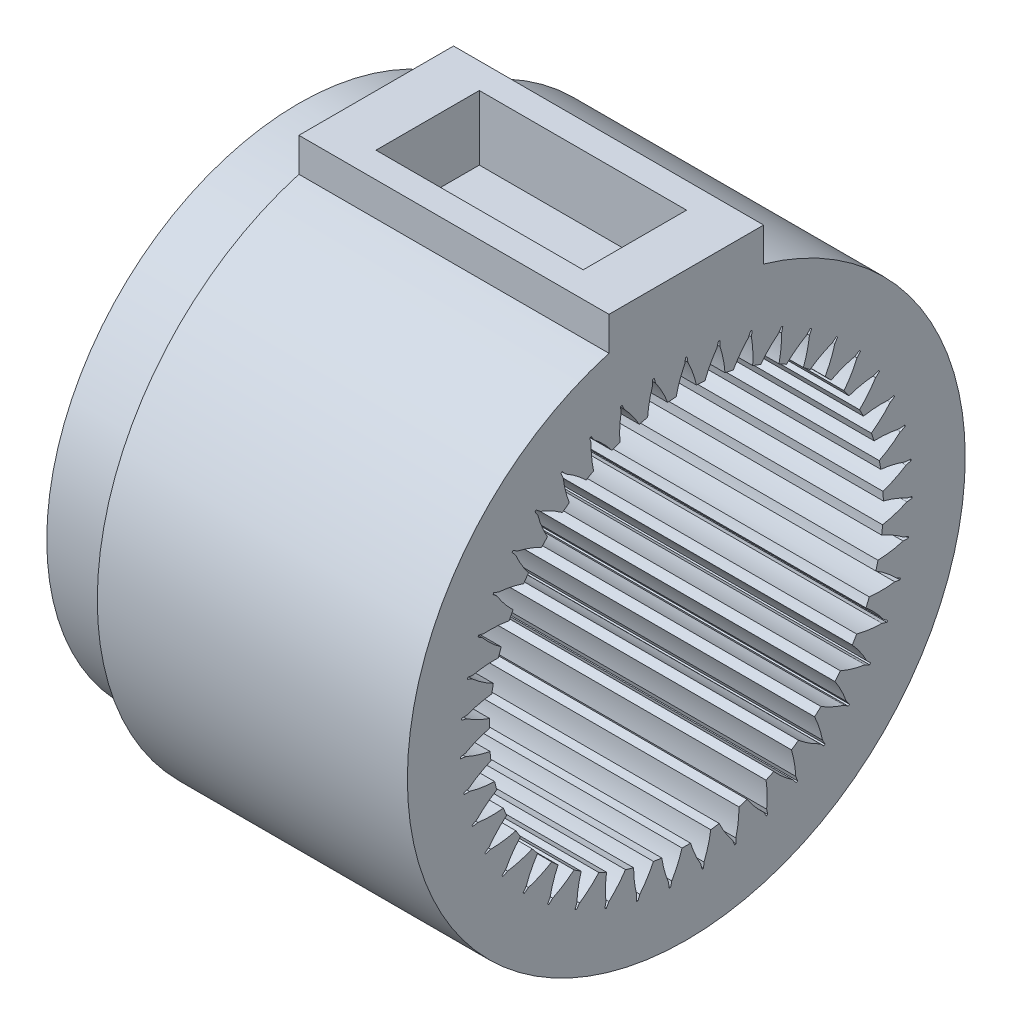
from build123d import *

# Parameters (mm, degrees)
BASPROSKE_W            = 78.047300112
BASPROSKE_H            = 4.5264
TOOTHCUT_DEPTH         = 102.176515302
TEETHCUTS_COUNT        = 43
TEETHCUTS_ANGLE        = 351.627906977
SCALE1_SCALE           = 0.373186685
SCALE2_SCALE           = 1.03
SKETCH2_R              = 19.499541689
SKETCH2_R_2            = 17.499541689
EXTRUDE_THIN1_DEPTH    = 4
BOSS_EXTRUDE2_DEPTH    = 24
BOSS_EXTRUDE3_DEPTH    = 11.9703915
SKETCH6_R              = 5
BOSS_EXTRUDE4_DEPTH    = 8
SKETCH7_R              = 4
CUT_EXTRUDE1_DEPTH     = 11.970392
SKETCH8_W              = 6
SKETCH8_H              = 6
BOSS_EXTRUDE5_DEPTH    = 2
CUT_EXTRUDE2_START     = -21.970391513
CUT_EXTRUDE2_OUTLINE_R = 1.665
CUT_EXTRUDE2_DEPTH     = 21.970391513
SKETCH10_R             = 2.5
CUT_EXTRUDE3_DEPTH     = 20
EXTRUDE_THIN2_START    = -23.999999605
SKETCH11_R             = 19.499541689
SKETCH11_R_2           = 17.499541689
EXTRUDE_THIN2_DEPTH    = 23.999999605
SKETCH12_R             = 2.7
BOSS_EXTRUDE6_DEPTH    = 8
SKETCH13_W             = 173.845873093
SKETCH13_H             = 84.02809251
CUT_EXTRUDE4_DEPTH     = 50
BOSS_EXTRUDE7_DEPTH    = 30
BOSS_EXTRUDE8_REACH    = 42.021
SKETCH15_R             = 19.499541689
SKETCH15_R_2           = 17.499541689
SKETCH16_R             = 21.589174891
SKETCH16_R_2           = 19.499541689
BOSS_EXTRUDE9_DEPTH    = 23.999999605
SKETCH17_W             = 16.039575366
SKETCH17_H             = 8
CUT_EXTRUDE5_DEPTH     = 5


with BuildPart() as part:
    # BasProSke → Base-Revolve (revolve)
    with BuildSketch(Plane(origin=(0, 0, 0), x_dir=(1, 0, 0), z_dir=(0, 1, 0)), mode=Mode.PRIVATE) as base_revolve_sk:
        with Locations((39.023650056, 43.2632)):
            Rectangle(BASPROSKE_W, BASPROSKE_H)
    revolve(base_revolve_sk.sketch.rotate(Axis((-10, 0, 0), (1, 0, 0)), 180), axis=Axis((-10, 0, 0), (1, 0, 0)))

    # TooCutSke → ToothCut (cut, through all)
    with BuildSketch(Plane(origin=(0, 0, 0), x_dir=(0, 0, -1), z_dir=(1, 0, 0))):
        with BuildLine():
            ThreePointArc((2.427408244, 40.90263481), (1.622102306, 43.254489753), (0.55070415, 45.497667258))
            ThreePointArc((0.55070415, 45.497667258), (0, 45.501), (-0.55070415, 45.497667258))
            ThreePointArc((-0.55070415, 45.497667258), (-1.622102306, 43.254489753), (-2.427408244, 40.90263481))
            ThreePointArc((-2.427408244, 40.90263481), (0, 40.9746), (2.427408244, 40.90263481))
        make_face()
    toothcut = extrude(amount=TOOTHCUT_DEPTH, mode=Mode.SUBTRACT)

    # TeethCuts: ToothCut ×43 about axis
    teethcuts_axis = Axis((-10, 0, 0), (1, 0, 0))
    for i in range(1, TEETHCUTS_COUNT):
        add(toothcut.rotate(teethcuts_axis, i * TEETHCUTS_ANGLE / (TEETHCUTS_COUNT - 1)), mode=Mode.SUBTRACT)


with BuildPart() as part_1:
    # Scale1: scaled about (39.023650056, 0, 0)
    add(part.part.scale(SCALE1_SCALE).moved(Location((24.460543452, 0, 0))))


with BuildPart() as part_2:
    # Scale2: scaled about (39.023650056, 0, 0)
    add(part_1.part.scale(SCALE2_SCALE).moved(Location((-1.170709502, 0, 0))))



with BuildPart() as body_2:
    # Sketch2 → Extrude-Thin1 (new body)
    with BuildSketch(Plane.ZY.offset(-24.023650253)):
        Circle(SKETCH2_R)
        Circle(SKETCH2_R_2, mode=Mode.SUBTRACT)
    extrude(amount=-EXTRUDE_THIN1_DEPTH)



with BuildPart() as body_3:
    # Sketch4 → Boss-Extrude2 (new, through all)
    with BuildSketch(Plane(origin=(30.023650253, 0, 0), x_dir=(0, 0, -1), z_dir=(1, 0, 0))):
        with BuildLine():
            Line((-5.985195757, 61.444190192), (5.985195757, 61.444190192))
            Line((5.985195757, 61.444190192), (5.985195757, 16.444190192))
            ThreePointArc((5.985195757, 16.444190192), (0, 17.499541689), (-5.985195757, 16.444190192))
            Line((-5.985195757, 16.444190192), (-5.985195757, 61.444190192))
        make_face()
    extrude(amount=BOSS_EXTRUDE2_DEPTH)

    # Sketch5 → Boss-Extrude3 (add)
    with BuildSketch(Plane.XY.offset(5.985195757)):
        Polygon((30.023650253, 46.444190192), (17.023650056, 53.927504623), (17.023650056, 66.91737825), (32.023650056, 96.91737825), (42.023650056, 96.91737825), (52.023650056, 96.91737825), (67.023650056, 66.91737825), (67.023650056, 53.927504623), (54.023649859, 46.444190192), (54.023649859, 61.444190192), (57.023650056, 61.444190192), (57.023650056, 66.91737825), (27.023650056, 66.91737825), (27.023650056, 61.444190192), (30.023650253, 61.444190192), align=None)
    extrude(amount=-BOSS_EXTRUDE3_DEPTH)

    # Sketch6 → Boss-Extrude4 (add)
    with BuildSketch(Plane.XY.offset(5.985195757)):
        with Locations((22.023650056, 66.444190192)):
            Circle(SKETCH6_R)
        with Locations((62.023650056, 66.444190192)):
            Circle(SKETCH6_R)
    extrude(amount=BOSS_EXTRUDE4_DEPTH)

    # Sketch7 → Cut-Extrude1 (cut)
    with BuildSketch(Plane.XY.offset(5.985195757)):
        with Locations((47.023650056, 46.444190192)):
            Circle(SKETCH7_R)
    extrude(amount=-CUT_EXTRUDE1_DEPTH, mode=Mode.SUBTRACT)

    # Sketch8 → Boss-Extrude5 (add, symmetric)
    with BuildSketch(Plane(origin=(0, 0, -5.985195757), x_dir=(-1, 0, 0), z_dir=(0, 0, -1))):
        Polygon((-54.023649859, 27.444190192), (-66.023650056, 27.444190192), (-66.023650056, 33.444190192), (-49.523649859, 33.444190192), (-46.523649859, 33.444190192), (-46.523649859, 27.444190192), align=None)
        with Locations((-31.023650056, 30.444190192)):
            Rectangle(SKETCH8_W, SKETCH8_H)
        with Locations((-63.023650056, 62.444190192)):
            Rectangle(SKETCH8_W, SKETCH8_H)
        with Locations((-31.023650056, 62.444190192)):
            Rectangle(SKETCH8_W, SKETCH8_H)
    extrude(amount=BOSS_EXTRUDE5_DEPTH, both=True)

    # Cut-Extrude2: read off the stored shape, not the designer's step
    # Cut-Extrude2 outline → Cut-Extrude2 (cut)
    with BuildSketch(Plane(origin=(0, 0, -7.985195757), x_dir=(-1, 0, 0), z_dir=(0, 0, -1)).offset(CUT_EXTRUDE2_START)):
        with Locations((-31.023650056, 62.444190192)):
            Circle(CUT_EXTRUDE2_OUTLINE_R)
        with Locations((-63.023650056, 62.444190192)):
            Circle(CUT_EXTRUDE2_OUTLINE_R)
        with Locations((-31.023650056, 30.444190192)):
            Circle(CUT_EXTRUDE2_OUTLINE_R)
        with Locations((-63.023650056, 30.444190192)):
            Circle(CUT_EXTRUDE2_OUTLINE_R)
    extrude(amount=CUT_EXTRUDE2_DEPTH, mode=Mode.SUBTRACT)

    # Sketch10 → Cut-Extrude3 (cut)
    with BuildSketch(Plane.XY.offset(13.985195757)):
        with Locations((31.023650056, 62.444190192)):
            Circle(SKETCH10_R)
        with Locations((31.023650056, 30.444190192)):
            Circle(SKETCH10_R)
        with Locations((63.023650056, 30.444190192)):
            Circle(SKETCH10_R)
        with Locations((63.023650056, 62.444190192)):
            Circle(SKETCH10_R)
    extrude(amount=-CUT_EXTRUDE3_DEPTH, mode=Mode.SUBTRACT)


with BuildPart() as part_3:
    add(part_2.part)

    add(body_3.part)  # Extrude-Thin2 merges body 3
    # Sketch11 → Extrude-Thin2 (add)
    with BuildSketch(Plane.ZY.offset(-30.023650253).offset(EXTRUDE_THIN2_START)):
        Circle(SKETCH11_R)
        Circle(SKETCH11_R_2, mode=Mode.SUBTRACT)
    extrude(amount=EXTRUDE_THIN2_DEPTH)

    # Sketch12 → Boss-Extrude6 (add)
    with BuildSketch(Plane.XY.offset(5.985195757)):
        with Locations(Location((36.141395741, 90.320034105, 0), (0, 0, 180))):
            Circle(SKETCH12_R)
        with Locations(Location((47.905904371, 90.320034105, 0), (0, 0, 180))):
            Circle(SKETCH12_R)
    extrude(amount=BOSS_EXTRUDE6_DEPTH)

    # Sketch13 → Cut-Extrude4 (cut, symmetric)
    with BuildSketch(Plane.XY.offset(5.985195757)):
        with Locations((46.749603736, 65.369634707)):
            Rectangle(SKETCH13_W, SKETCH13_H)
    extrude(amount=CUT_EXTRUDE4_DEPTH, both=True, mode=Mode.SUBTRACT)


with BuildPart() as body_2_1:
    add(body_2.part)

    add(part_3.part)  # Boss-Extrude7 merges part
    # Sketch14 → Boss-Extrude7 (add, through all)
    with BuildSketch(Plane(origin=(54.023649859, 0, 0), x_dir=(0, 0, -1), z_dir=(1, 0, 0))):
        with BuildLine():
            Line((-17.073266461, -0.747290891), (-17.475823879, -0.698518082))
            ThreePointArc((-17.475823879, -0.698518082), (-17.472626074, -0.774393841), (-17.469098837, -0.850255))
            ThreePointArc((-17.469098837, -0.850255), (-16.597243262, -1.228538149), (-15.687722275, -1.504222496))
            ThreePointArc((-15.687722275, -1.504222496), (-15.665131038, -1.723654557), (-15.639470648, -1.942748915))
            ThreePointArc((-15.639470648, -1.942748915), (-16.467290047, -2.409595065), (-17.236037071, -2.968395833))
            ThreePointArc((-17.236037071, -2.968395833), (-17.222985417, -3.043209007), (-17.209609037, -3.117964805))
            Line((-17.209609037, -3.117964805), (-16.827287133, -2.982830712))
            ThreePointArc((-16.827287133, -2.982830712), (-16.00364301, -2.436275755), (-15.118882336, -1.995469092))
            ThreePointArc((-15.118882336, -1.995469092), (-15.158514872, -1.667910928), (-15.191051539, -1.339571996))
            ThreePointArc((-15.191051539, -1.339571996), (-16.15048976, -1.101684914), (-17.073266461, -0.747290891))
        make_face()
        with BuildLine():
            Line((-17.000129371, 1.746560246), (-17.391295504, 1.853426132))
            ThreePointArc((-17.391295504, 1.853426132), (-17.399179377, 1.777893349), (-17.406735202, 1.702327045))
            ThreePointArc((-17.406735202, 1.702327045), (-16.599249138, 1.20113193), (-15.739560545, 0.795958131))
            ThreePointArc((-15.739560545, 0.795958131), (-15.749159619, 0.575575167), (-15.755673076, 0.355079434))
            ThreePointArc((-15.755673076, 0.355079434), (-16.642644054, 0.013739763), (-17.484560868, -0.427175606))
            ThreePointArc((-17.484560868, -0.427175606), (-17.482541186, -0.50309186), (-17.480191885, -0.57899863))
            Line((-17.480191885, -0.57899863), (-17.082268563, -0.500971126))
            ThreePointArc((-17.082268563, -0.500971126), (-16.187822671, -0.080164151), (-15.248308602, 0.227122811))
            ThreePointArc((-15.248308602, 0.227122811), (-15.239825938, 0.556960852), (-15.224209341, 0.886538173))
            ThreePointArc((-15.224209341, 0.886538173), (-16.138786545, 1.261585505), (-17.000129371, 1.746560246))
        make_face()
        with BuildLine():
            Line((-16.564664038, 4.203186485), (-16.93610186, 4.365867786))
            ThreePointArc((-16.93610186, 4.365867786), (-16.954899379, 4.292287829), (-16.973377226, 4.218626944))
            ThreePointArc((-16.973377226, 4.218626944), (-16.247470839, 3.605201967), (-15.455937408, 3.079174294))
            ThreePointArc((-15.455937408, 3.079174294), (-15.497522206, 2.862537505), (-15.536070687, 2.645339881))
            ThreePointArc((-15.536070687, 2.645339881), (-16.463288996, 2.436781752), (-17.360431605, 2.123149127))
            ThreePointArc((-17.360431605, 2.123149127), (-17.369486942, 2.047747816), (-17.378214791, 1.972307896))
            Line((-17.378214791, 1.972307896), (-16.973171095, 1.991565789))
            ThreePointArc((-16.973171095, 1.991565789), (-16.026986998, 2.277656013), (-15.052743644, 2.444873985))
            ThreePointArc((-15.052743644, 2.444873985), (-14.996326572, 2.769961977), (-14.932889553, 3.09375332))
            ThreePointArc((-14.932889553, 3.09375332), (-15.783113114, 3.59796742), (-16.564664038, 4.203186485))
        make_face()
        with BuildLine():
            Line((-15.77615165, 6.5702291), (-16.119944609, 6.785258548))
            ThreePointArc((-16.119944609, 6.785258548), (-16.149255136, 6.715199646), (-16.178261183, 6.645014134))
            ThreePointArc((-16.178261183, 6.645014134), (-15.549405906, 5.932433384), (-14.842897799, 5.296763201))
            ThreePointArc((-14.842897799, 5.296763201), (-14.915582012, 5.088489827), (-14.985343925, 4.879219502))
            ThreePointArc((-14.985343925, 4.879219502), (-15.933047516, 4.807887969), (-16.866294884, 4.628222622))
            ThreePointArc((-16.866294884, 4.628222622), (-16.88623224, 4.554943303), (-16.905851219, 4.481578104))
            Line((-16.905851219, 4.481578104), (-16.502319954, 4.441655937))
            ThreePointArc((-16.502319954, 4.441655937), (-15.524563921, 4.586931893), (-14.536355588, 4.610516915))
            ThreePointArc((-14.536355588, 4.610516915), (-14.433206541, 4.923926173), (-14.323301149, 5.235030486))
            ThreePointArc((-14.323301149, 5.235030486), (-15.09105003, 5.857664905), (-15.77615165, 6.5702291))
        make_face()
        with BuildLine():
            Line((-14.65139798, 8.79723869), (-14.960218724, 9.060033304))
            ThreePointArc((-14.960218724, 9.060033304), (-14.999417559, 8.994988641), (-15.038333591, 8.929774384))
            ThreePointArc((-15.038333591, 8.929774384), (-14.519932382, 8.133225282), (-13.913507593, 7.401460798))
            ThreePointArc((-13.913507593, 7.401460798), (-14.015742084, 7.205989822), (-14.115230573, 7.00910703))
            ThreePointArc((-14.115230573, 7.00910703), (-15.063220791, 7.0765224), (-16.012682369, 7.034653588))
            ThreePointArc((-16.012682369, 7.034653588), (-16.043076814, 6.965058081), (-16.07316878, 6.895331255))
            Line((-16.07316878, 6.895331255), (-15.679750513, 6.7970799))
            ThreePointArc((-15.679750513, 6.7970799), (-14.691261718, 6.798445284), (-13.71015035, 6.677894682))
            ThreePointArc((-13.71015035, 6.677894682), (-13.56246777, 6.97294543), (-13.408436449, 7.264732066))
            ThreePointArc((-13.408436449, 7.264732066), (-14.077347414, 7.992516433), (-14.65139798, 8.79723869))
        make_face()
        with BuildLine():
            Line((-13.214375198, 10.83675041), (-13.481641751, 11.14170918))
            ThreePointArc((-13.481641751, 11.14170918), (-13.529893437, 11.08306507), (-13.577890027, 11.024211997))
            ThreePointArc((-13.577890027, 11.024211997), (-13.180991709, 10.160671604), (-12.687575129, 9.348409107))
            ThreePointArc((-12.687575129, 9.348409107), (-12.817180947, 9.169906655), (-12.944275588, 8.98960761))
            ThreePointArc((-12.944275588, 8.98960761), (-13.872347666, 9.194333043), (-14.81778733, 9.291153125))
            ThreePointArc((-14.81778733, 9.291153125), (-14.85799106, 9.226724739), (-14.897914654, 9.162122391))
            Line((-14.897914654, 9.162122391), (-14.522994413, 9.007635906))
            ThreePointArc((-14.522994413, 9.007635906), (-13.544840777, 8.865061617), (-12.591737061, 8.602944717))
            ThreePointArc((-12.591737061, 8.602944717), (-12.402668546, 8.873348462), (-12.207794205, 9.139598495))
            ThreePointArc((-12.207794205, 9.139598495), (-12.763610578, 9.957021349), (-13.214375198, 10.83675041))
        make_face()
        with BuildLine():
            Line((-11.495710951, 12.645295609), (-11.71572699, 12.985918868))
            ThreePointArc((-11.71572699, 12.985918868), (-11.772003126, 12.934925208), (-11.828057311, 12.883687671))
            ThreePointArc((-11.828057311, 12.883687671), (-11.561121081, 11.971560851), (-11.191229028, 11.096112307))
            ThreePointArc((-11.191229028, 11.096112307), (-11.34544385, 10.938382848), (-11.497435842, 10.778510312))
            ThreePointArc((-11.497435842, 10.778510312), (-12.385809536, 11.116182439), (-13.30707688, 11.349627865))
            ThreePointArc((-13.30707688, 11.349627865), (-13.356233021, 11.291739778), (-13.405137342, 11.233638795))
            Line((-13.405137342, 11.233638795), (-13.0567059, 11.026209791))
            ThreePointArc((-13.0567059, 11.026209791), (-12.109735071, 10.742734552), (-11.204952757, 10.344637921))
            ThreePointArc((-11.204952757, 10.344637921), (-10.978527975, 10.584631477), (-10.746964022, 10.81967025))
            ThreePointArc((-10.746964022, 10.81967025), (-11.177839542, 11.709309642), (-11.495710951, 12.645295609))
        make_face()
        with BuildLine():
            Line((-9.532035584, 14.184328287), (-9.700111849, 14.553356241))
            ThreePointArc((-9.700111849, 14.553356241), (-9.763213007, 14.511099873), (-9.826130088, 14.46856991))
            ThreePointArc((-9.826130088, 14.46856991), (-9.69484523, 13.527297064), (-9.456361311, 12.607321137))
            ThreePointArc((-9.456361311, 12.607321137), (-9.631898315, 12.473726401), (-9.805548212, 12.337687779))
            ThreePointArc((-9.805548212, 12.337687779), (-10.635289379, 12.801109706), (-11.512749189, 13.166204991))
            ThreePointArc((-11.512749189, 13.166204991), (-11.569810065, 13.116090988), (-11.626652801, 13.065729692))
            Line((-11.626652801, 13.065729692), (-11.31213637, 12.809779158))
            ThreePointArc((-11.31213637, 12.809779158), (-10.416531386, 12.391444751), (-9.579354338, 11.865853128))
            ThreePointArc((-9.579354338, 11.865853128), (-9.32039914, 12.070321449), (-9.057080959, 12.269139517))
            ThreePointArc((-9.057080959, 12.269139517), (-9.353832263, 13.212034329), (-9.532035584, 14.184328287))
        make_face()
        with BuildLine():
            Line((-7.365201427, 15.421046633), (-7.477755664, 15.810614092))
            ThreePointArc((-7.477755664, 15.810614092), (-7.546336953, 15.777995638), (-7.614775962, 15.745079701))
            ThreePointArc((-7.614775962, 15.745079701), (-7.621940584, 14.794722424), (-7.519947669, 13.849826805))
            ThreePointArc((-7.519947669, 13.849826805), (-7.71306559, 13.743214132), (-7.904672346, 13.633908852))
            ThreePointArc((-7.904672346, 13.633908852), (-8.658096493, 14.213203544), (-9.473047237, 14.702167316))
            ThreePointArc((-9.473047237, 14.702167316), (-9.536796693, 14.66089549), (-9.600366341, 14.619347245))
            Line((-9.600366341, 14.619347245), (-9.326468293, 14.320330321))
            ThreePointArc((-9.326468293, 14.320330321), (-8.501317419, 13.776052819), (-7.749588613, 13.134168277))
            ThreePointArc((-7.749588613, 13.134168277), (-7.463622179, 13.298753474), (-7.17416194, 13.457113377))
            ThreePointArc((-7.17416194, 13.457113377), (-7.330464289, 14.433167443), (-7.365201427, 15.421046633))
        make_face()
        with BuildLine():
            Line((-5.041390789, 16.329092144), (-5.0960241, 16.730896154))
            ThreePointArc((-5.0960241, 16.730896154), (-5.168623828, 16.708610818), (-5.241126107, 16.686010454))
            ThreePointArc((-5.241126107, 16.686010454), (-5.386587507, 15.746823962), (-5.423259399, 14.797147461))
            ThreePointArc((-5.423259399, 14.797147461), (-5.629842263, 14.719789115), (-5.835322113, 14.639546828))
            ThreePointArc((-5.835322113, 14.639546828), (-6.496371312, 15.322367625), (-7.23144373, 15.92477847))
            ThreePointArc((-7.23144373, 15.92477847), (-7.300523058, 15.893228458), (-7.36946474, 15.861378792))
            Line((-7.36946474, 15.861378792), (-7.142022736, 15.525668506))
            ThreePointArc((-7.142022736, 15.525668506), (-6.404912632, 14.867048238), (-5.754653862, 14.122551431))
            ThreePointArc((-5.754653862, 14.122551431), (-5.447771069, 14.243745658), (-5.138338115, 14.358272229))
            ThreePointArc((-5.138338115, 14.358272229), (-5.150860196, 15.346682651), (-5.041390789, 16.329092144))
        make_face()
        with BuildLine():
            Line((-2.610131659, 16.889111405), (-2.605679629, 17.294588212))
            ThreePointArc((-2.605679629, 17.294588212), (-2.68075046, 17.283110967), (-2.755770748, 17.271307864))
            ThreePointArc((-2.755770748, 17.271307864), (-3.03642867, 16.363309287), (-3.21098377, 15.429092608))
            ThreePointArc((-3.21098377, 15.429092608), (-3.426628622, 15.382637348), (-3.64160212, 15.333168279))
            ThreePointArc((-3.64160212, 15.333168279), (-4.196187255, 16.104962043), (-4.835714555, 16.807980619))
            ThreePointArc((-4.835714555, 16.807980619), (-4.908651448, 16.786824855), (-4.981495793, 16.765352588))
            Line((-4.981495793, 16.765352588), (-4.805357364, 16.400104022))
            ThreePointArc((-4.805357364, 16.400104022), (-4.171998251, 15.641178336), (-3.637068654, 14.809936921))
            ThreePointArc((-3.637068654, 14.809936921), (-3.315810178, 14.885157133), (-2.992999534, 14.953409437))
            ThreePointArc((-2.992999534, 14.953409437), (-2.86147446, 15.933109962), (-2.610131659, 16.889111405))
        make_face()
        with BuildLine():
            Line((-0.123242104, 17.089168579), (-0.059799621, 17.489676148))
            ThreePointArc((-0.059799621, 17.489676148), (-0.13574155, 17.489251613), (-0.21168092, 17.488497332))
            ThreePointArc((-0.21168092, 17.488497332), (-0.621553627, 16.631039082), (-0.930271597, 15.732193434))
            ThreePointArc((-0.930271597, 15.732193434), (-1.150382342, 15.717631372), (-1.3702677, 15.69998987))
            ThreePointArc((-1.3702677, 15.69998987), (-1.806568753, 16.544307154), (-2.336920519, 17.332949842))
            ThreePointArc((-2.336920519, 17.332949842), (-2.412160455, 17.322639224), (-2.487354912, 17.312002001))
            Line((-2.487354912, 17.312002001), (-2.366274143, 16.924999793))
            ThreePointArc((-2.366274143, 16.924999793), (-1.850164971, 16.081943872), (-1.441965642, 15.181674318))
            ThreePointArc((-1.441965642, 15.181674318), (-1.113178549, 15.209317326), (-0.783870364, 15.229840684))
            ThreePointArc((-0.783870364, 15.229840684), (-0.511101364, 16.179950696), (-0.123242104, 17.089168579))
        make_face()
        with BuildLine():
            Line((2.366274143, 16.924999793), (2.487354912, 17.312002001))
            ThreePointArc((2.487354912, 17.312002001), (2.412160455, 17.322639224), (2.336920519, 17.332949842))
            ThreePointArc((2.336920519, 17.332949842), (1.806568753, 16.544307154), (1.3702677, 15.69998987))
            ThreePointArc((1.3702677, 15.69998987), (1.150382342, 15.717631372), (0.930271597, 15.732193434))
            ThreePointArc((0.930271597, 15.732193434), (0.621553627, 16.631039082), (0.21168092, 17.488497332))
            ThreePointArc((0.21168092, 17.488497332), (0.13574155, 17.489251613), (0.059799621, 17.489676148))
            Line((0.059799621, 17.489676148), (0.123242104, 17.089168579))
            ThreePointArc((0.123242104, 17.089168579), (0.511101364, 16.179950696), (0.783870364, 15.229840684))
            ThreePointArc((0.783870364, 15.229840684), (1.113178549, 15.209317326), (1.441965642, 15.181674318))
            ThreePointArc((1.441965642, 15.181674318), (1.850164971, 16.081943872), (2.366274143, 16.924999793))
        make_face()
        with BuildLine():
            Line((4.805357364, 16.400104022), (4.981495793, 16.765352588))
            ThreePointArc((4.981495793, 16.765352588), (4.908651448, 16.786824855), (4.835714555, 16.807980619))
            ThreePointArc((4.835714555, 16.807980619), (4.196187255, 16.104962043), (3.64160212, 15.333168279))
            ThreePointArc((3.64160212, 15.333168279), (3.426628622, 15.382637348), (3.21098377, 15.429092608))
            ThreePointArc((3.21098377, 15.429092608), (3.03642867, 16.363309287), (2.755770748, 17.271307864))
            ThreePointArc((2.755770748, 17.271307864), (2.68075046, 17.283110967), (2.605679629, 17.294588212))
            Line((2.605679629, 17.294588212), (2.610131659, 16.889111405))
            ThreePointArc((2.610131659, 16.889111405), (2.86147446, 15.933109962), (2.992999534, 14.953409437))
            ThreePointArc((2.992999534, 14.953409437), (3.315810178, 14.885157133), (3.637068654, 14.809936921))
            ThreePointArc((3.637068654, 14.809936921), (4.171998251, 15.641178336), (4.805357364, 16.400104022))
        make_face()
        with BuildLine():
            Line((7.142022736, 15.525668506), (7.36946474, 15.861378792))
            ThreePointArc((7.36946474, 15.861378792), (7.300523058, 15.893228458), (7.23144373, 15.92477847))
            ThreePointArc((7.23144373, 15.92477847), (6.496371312, 15.322367625), (5.835322113, 14.639546828))
            ThreePointArc((5.835322113, 14.639546828), (5.629842263, 14.719789115), (5.423259399, 14.797147461))
            ThreePointArc((5.423259399, 14.797147461), (5.386587507, 15.746823962), (5.241126107, 16.686010454))
            ThreePointArc((5.241126107, 16.686010454), (5.168623828, 16.708610818), (5.0960241, 16.730896154))
            Line((5.0960241, 16.730896154), (5.041390789, 16.329092144))
            ThreePointArc((5.041390789, 16.329092144), (5.150860196, 15.346682651), (5.138338115, 14.358272229))
            ThreePointArc((5.138338115, 14.358272229), (5.447771069, 14.243745658), (5.754653862, 14.122551431))
            ThreePointArc((5.754653862, 14.122551431), (6.404912632, 14.867048238), (7.142022736, 15.525668506))
        make_face()
        with BuildLine():
            Line((9.326468293, 14.320330321), (9.600366341, 14.619347245))
            ThreePointArc((9.600366341, 14.619347245), (9.536796693, 14.66089549), (9.473047237, 14.702167316))
            ThreePointArc((9.473047237, 14.702167316), (8.658096493, 14.213203544), (7.904672346, 13.633908852))
            ThreePointArc((7.904672346, 13.633908852), (7.71306559, 13.743214132), (7.519947669, 13.849826805))
            ThreePointArc((7.519947669, 13.849826805), (7.621940584, 14.794722424), (7.614775962, 15.745079701))
            ThreePointArc((7.614775962, 15.745079701), (7.546336953, 15.777995638), (7.477755664, 15.810614092))
            Line((7.477755664, 15.810614092), (7.365201427, 15.421046633))
            ThreePointArc((7.365201427, 15.421046633), (7.330464289, 14.433167443), (7.17416194, 13.457113377))
            ThreePointArc((7.17416194, 13.457113377), (7.463622179, 13.298753474), (7.749588613, 13.134168277))
            ThreePointArc((7.749588613, 13.134168277), (8.501317419, 13.776052819), (9.326468293, 14.320330321))
        make_face()
        with BuildLine():
            Line((11.31213637, 12.809779158), (11.626652801, 13.065729692))
            ThreePointArc((11.626652801, 13.065729692), (11.569810065, 13.116090988), (11.512749189, 13.166204991))
            ThreePointArc((11.512749189, 13.166204991), (10.635289379, 12.801109706), (9.805548212, 12.337687779))
            ThreePointArc((9.805548212, 12.337687779), (9.631898315, 12.473726401), (9.456361311, 12.607321137))
            ThreePointArc((9.456361311, 12.607321137), (9.69484523, 13.527297064), (9.826130088, 14.46856991))
            ThreePointArc((9.826130088, 14.46856991), (9.763213007, 14.511099873), (9.700111849, 14.553356241))
            Line((9.700111849, 14.553356241), (9.532035584, 14.184328287))
            ThreePointArc((9.532035584, 14.184328287), (9.353832263, 13.212034329), (9.057080959, 12.269139517))
            ThreePointArc((9.057080959, 12.269139517), (9.32039914, 12.070321449), (9.579354338, 11.865853128))
            ThreePointArc((9.579354338, 11.865853128), (10.416531386, 12.391444751), (11.31213637, 12.809779158))
        make_face()
        with BuildLine():
            Line((13.0567059, 11.026209791), (13.405137342, 11.233638795))
            ThreePointArc((13.405137342, 11.233638795), (13.356233021, 11.291739778), (13.30707688, 11.349627865))
            ThreePointArc((13.30707688, 11.349627865), (12.385809536, 11.116182439), (11.497435842, 10.778510312))
            ThreePointArc((11.497435842, 10.778510312), (11.34544385, 10.938382848), (11.191229028, 11.096112307))
            ThreePointArc((11.191229028, 11.096112307), (11.561121081, 11.971560851), (11.828057311, 12.883687671))
            ThreePointArc((11.828057311, 12.883687671), (11.772003126, 12.934925208), (11.71572699, 12.985918868))
            Line((11.71572699, 12.985918868), (11.495710951, 12.645295609))
            ThreePointArc((11.495710951, 12.645295609), (11.177839542, 11.709309642), (10.746964022, 10.81967025))
            ThreePointArc((10.746964022, 10.81967025), (10.978527975, 10.584631477), (11.204952757, 10.344637921))
            ThreePointArc((11.204952757, 10.344637921), (12.109735071, 10.742734552), (13.0567059, 11.026209791))
        make_face()
        with BuildLine():
            Line((14.522994413, 9.007635906), (14.897914654, 9.162122391))
            ThreePointArc((14.897914654, 9.162122391), (14.85799106, 9.226724739), (14.81778733, 9.291153125))
            ThreePointArc((14.81778733, 9.291153125), (13.872347666, 9.194333043), (12.944275588, 8.98960761))
            ThreePointArc((12.944275588, 8.98960761), (12.817180947, 9.169906655), (12.687575129, 9.348409107))
            ThreePointArc((12.687575129, 9.348409107), (13.180991709, 10.160671604), (13.577890027, 11.024211997))
            ThreePointArc((13.577890027, 11.024211997), (13.529893437, 11.08306507), (13.481641751, 11.14170918))
            Line((13.481641751, 11.14170918), (13.214375198, 10.83675041))
            ThreePointArc((13.214375198, 10.83675041), (12.763610578, 9.957021349), (12.207794205, 9.139598495))
            ThreePointArc((12.207794205, 9.139598495), (12.402668546, 8.873348462), (12.591737061, 8.602944717))
            ThreePointArc((12.591737061, 8.602944717), (13.544840777, 8.865061617), (14.522994413, 9.007635906))
        make_face()
        with BuildLine():
            Line((15.679750513, 6.7970799), (16.07316878, 6.895331255))
            ThreePointArc((16.07316878, 6.895331255), (16.043076814, 6.965058081), (16.012682369, 7.034653588))
            ThreePointArc((16.012682369, 7.034653588), (15.063220791, 7.0765224), (14.115230573, 7.00910703))
            ThreePointArc((14.115230573, 7.00910703), (14.015742084, 7.205989822), (13.913507593, 7.401460798))
            ThreePointArc((13.913507593, 7.401460798), (14.519932382, 8.133225282), (15.038333591, 8.929774384))
            ThreePointArc((15.038333591, 8.929774384), (14.999417559, 8.994988641), (14.960218724, 9.060033304))
            Line((14.960218724, 9.060033304), (14.65139798, 8.79723869))
            ThreePointArc((14.65139798, 8.79723869), (14.077347414, 7.992516433), (13.408436449, 7.264732066))
            ThreePointArc((13.408436449, 7.264732066), (13.56246777, 6.97294543), (13.71015035, 6.677894682))
            ThreePointArc((13.71015035, 6.677894682), (14.691261718, 6.798445284), (15.679750513, 6.7970799))
        make_face()
        with BuildLine():
            Line((16.502319954, 4.441655937), (16.905851219, 4.481578104))
            ThreePointArc((16.905851219, 4.481578104), (16.88623224, 4.554943303), (16.866294884, 4.628222622))
            ThreePointArc((16.866294884, 4.628222622), (15.933047516, 4.807887969), (14.985343925, 4.879219502))
            ThreePointArc((14.985343925, 4.879219502), (14.915582012, 5.088489827), (14.842897799, 5.296763201))
            ThreePointArc((14.842897799, 5.296763201), (15.549405906, 5.932433384), (16.178261183, 6.645014134))
            ThreePointArc((16.178261183, 6.645014134), (16.149255136, 6.715199646), (16.119944609, 6.785258548))
            Line((16.119944609, 6.785258548), (15.77615165, 6.5702291))
            ThreePointArc((15.77615165, 6.5702291), (15.09105003, 5.857664905), (14.323301149, 5.235030486))
            ThreePointArc((14.323301149, 5.235030486), (14.433206541, 4.923926173), (14.536355588, 4.610516915))
            ThreePointArc((14.536355588, 4.610516915), (15.524563921, 4.586931893), (16.502319954, 4.441655937))
        make_face()
        with BuildLine():
            Line((16.973171095, 1.991565789), (17.378214791, 1.972307896))
            ThreePointArc((17.378214791, 1.972307896), (17.369486942, 2.047747816), (17.360431605, 2.123149127))
            ThreePointArc((17.360431605, 2.123149127), (16.463288996, 2.436781752), (15.536070687, 2.645339881))
            ThreePointArc((15.536070687, 2.645339881), (15.497522206, 2.862537505), (15.455937408, 3.079174294))
            ThreePointArc((15.455937408, 3.079174294), (16.247470839, 3.605201967), (16.973377226, 4.218626944))
            ThreePointArc((16.973377226, 4.218626944), (16.954899379, 4.292287829), (16.93610186, 4.365867786))
            Line((16.93610186, 4.365867786), (16.564664038, 4.203186485))
            ThreePointArc((16.564664038, 4.203186485), (15.783113114, 3.59796742), (14.932889553, 3.09375332))
            ThreePointArc((14.932889553, 3.09375332), (14.996326572, 2.769961977), (15.052743644, 2.444873985))
            ThreePointArc((15.052743644, 2.444873985), (16.026986998, 2.277656013), (16.973171095, 1.991565789))
        make_face()
        with BuildLine():
            Line((17.082268563, -0.500971126), (17.480191885, -0.57899863))
            ThreePointArc((17.480191885, -0.57899863), (17.482541186, -0.50309186), (17.484560868, -0.427175606))
            ThreePointArc((17.484560868, -0.427175606), (16.642644054, 0.013739763), (15.755673076, 0.355079434))
            ThreePointArc((15.755673076, 0.355079434), (15.749159619, 0.575575167), (15.739560545, 0.795958131))
            ThreePointArc((15.739560545, 0.795958131), (16.599249138, 1.20113193), (17.406735202, 1.702327045))
            ThreePointArc((17.406735202, 1.702327045), (17.399179377, 1.777893349), (17.391295504, 1.853426132))
            Line((17.391295504, 1.853426132), (17.000129371, 1.746560246))
            ThreePointArc((17.000129371, 1.746560246), (16.138786545, 1.261585505), (15.224209341, 0.886538173))
            ThreePointArc((15.224209341, 0.886538173), (15.239825938, 0.556960852), (15.248308602, 0.227122811))
            ThreePointArc((15.248308602, 0.227122811), (16.187822671, -0.080164151), (17.082268563, -0.500971126))
        make_face()
        with BuildLine():
            Line((16.827287133, -2.982830712), (17.209609037, -3.117964805))
            ThreePointArc((17.209609037, -3.117964805), (17.222985417, -3.043209007), (17.236037071, -2.968395833))
            ThreePointArc((17.236037071, -2.968395833), (16.467290047, -2.409595065), (15.639470648, -1.942748915))
            ThreePointArc((15.639470648, -1.942748915), (15.665131038, -1.723654557), (15.687722275, -1.504222496))
            ThreePointArc((15.687722275, -1.504222496), (16.597243262, -1.228538149), (17.469098837, -0.850255))
            ThreePointArc((17.469098837, -0.850255), (17.472626074, -0.774393841), (17.475823879, -0.698518082))
            Line((17.475823879, -0.698518082), (17.073266461, -0.747290891))
            ThreePointArc((17.073266461, -0.747290891), (16.15048976, -1.101684914), (15.191051539, -1.339571996))
            ThreePointArc((15.191051539, -1.339571996), (15.158514872, -1.667910928), (15.118882336, -1.995469092))
            ThreePointArc((15.118882336, -1.995469092), (16.00364301, -2.436275755), (16.827287133, -2.982830712))
        make_face()
        with BuildLine():
            Line((16.213661293, -5.401116439), (16.572233252, -5.590476974))
            ThreePointArc((16.572233252, -5.590476974), (16.596351616, -5.518465438), (16.620157069, -5.446349855))
            ThreePointArc((16.620157069, -5.446349855), (15.940964343, -4.781573557), (15.189940055, -4.199170944))
            ThreePointArc((15.189940055, -4.199170944), (15.247227387, -3.986147577), (15.301527441, -3.772343233))
            ThreePointArc((15.301527441, -3.772343233), (16.24149596, -3.63202407), (17.15913896, -3.384715335))
            ThreePointArc((17.15913896, -3.384715335), (17.173674082, -3.310176171), (17.187885408, -3.235574595))
            Line((17.187885408, -3.235574595), (16.782516518, -3.225214821))
            ThreePointArc((16.782516518, -3.225214821), (15.817973325, -3.441474832), (14.834122848, -3.537131514))
            ThreePointArc((14.834122848, -3.537131514), (14.75412638, -3.857234081), (14.667223342, -4.175531035))
            ThreePointArc((14.667223342, -4.175531035), (15.478373482, -4.740462371), (16.213661293, -5.401116439))
        make_face()
        with BuildLine():
            Line((15.254469412, -7.704286747), (15.581649086, -7.943837832))
            ThreePointArc((15.581649086, -7.943837832), (15.615995394, -7.876105358), (15.650047274, -7.808224387))
            ThreePointArc((15.650047274, -7.808224387), (15.07488466, -7.051641111), (14.416662262, -6.366094935))
            ThreePointArc((14.416662262, -6.366094935), (14.504355554, -6.163682782), (14.589207115, -5.960063023))
            ThreePointArc((14.589207115, -5.960063023), (15.53958937, -5.958099704), (16.483461827, -5.847036339))
            ThreePointArc((16.483461827, -5.847036339), (16.508695042, -5.775407842), (16.533617, -5.703670454))
            Line((16.533617, -5.703670454), (16.134076373, -5.634398897))
            ThreePointArc((16.134076373, -5.634398897), (15.148324251, -5.707915689), (14.161030582, -5.659303214))
            ThreePointArc((14.161030582, -5.659303214), (14.035279299, -5.964346987), (13.902957947, -6.266598784))
            ThreePointArc((13.902957947, -6.266598784), (14.623209296, -6.943614262), (15.254469412, -7.704286747))
        make_face()
        with BuildLine():
            Line((13.970154999, -9.843253558), (14.258969123, -10.127889578))
            ThreePointArc((14.258969123, -10.127889578), (14.302811341, -10.065879767), (14.346383892, -10.003680172))
            ThreePointArc((14.346383892, -10.003680172), (13.887509983, -9.171415177), (13.336118342, -8.397336665))
            ThreePointArc((13.336118342, -8.397336665), (13.452348565, -8.209849789), (13.565943169, -8.020754418))
            ThreePointArc((13.565943169, -8.020754418), (14.506483411, -8.157188787), (15.456468322, -8.184737916))
            ThreePointArc((15.456468322, -8.184737916), (15.49186183, -8.117546722), (15.526963251, -8.050202479))
            Line((15.526963251, -8.050202479), (15.1417664, -7.923495542))
            ThreePointArc((15.1417664, -7.923495542), (14.155814946, -7.852702232), (13.186120534, -7.660856692))
            ThreePointArc((13.186120534, -7.660856692), (13.017294608, -7.944340192), (12.842375141, -8.224104859))
            ThreePointArc((12.842375141, -8.224104859), (13.456376792, -8.99877507), (13.970154999, -9.843253558))
        make_face()
        with BuildLine():
            Line((12.388090987, -11.77242851), (12.632383988, -12.096082942))
            ThreePointArc((12.632383988, -12.096082942), (12.684787697, -12.041117425), (12.736952244, -11.985924882))
            ThreePointArc((12.736952244, -11.985924882), (12.404147141, -11.095716452), (11.971338213, -10.249603742))
            ThreePointArc((11.971338213, -10.249603742), (12.113628122, -10.081038102), (12.253544696, -9.910497357))
            ThreePointArc((12.253544696, -9.910497357), (13.164196944, -10.182421553), (14.10004703, -10.347996013))
            ThreePointArc((14.10004703, -10.347996013), (14.144846479, -10.286674188), (14.189379237, -10.225158415))
            Line((14.189379237, -10.225158415), (13.826735966, -10.043716635))
            ThreePointArc((13.826735966, -10.043716635), (12.861599022, -9.830122061), (11.930171221, -9.499132309))
            ThreePointArc((11.930171221, -9.499132309), (11.721868882, -9.755013579), (11.508079405, -10.006328418))
            ThreePointArc((11.508079405, -10.006328418), (12.002744979, -10.862142611), (12.388090987, -11.77242851))
        make_face()
        with BuildLine():
            Line((10.541996323, -13.450694586), (10.73656152, -13.806469298))
            ThreePointArc((10.73656152, -13.806469298), (10.796409825, -13.759719569), (10.856054573, -13.712710412))
            ThreePointArc((10.856054573, -13.712710412), (10.656411438, -12.783531794), (10.351409794, -11.883418311))
            ThreePointArc((10.351409794, -11.883418311), (10.516726726, -11.737366589), (10.679983193, -11.589015251))
            ThreePointArc((10.679983193, -11.589015251), (11.541338474, -11.990633682), (12.443107716, -12.290704541))
            ThreePointArc((12.443107716, -12.290704541), (12.496358282, -12.236559052), (12.549373239, -12.182182852))
            Line((12.549373239, -12.182182852), (12.217012659, -11.949873347))
            ThreePointArc((12.217012659, -11.949873347), (11.293260444, -11.598029905), (10.419951021, -11.134950414))
            ThreePointArc((10.419951021, -11.134950414), (10.176611871, -11.357775787), (9.928508936, -11.575284459))
            ThreePointArc((9.928508936, -11.575284459), (10.293295495, -12.49400244), (10.541996323, -13.450694586))
        make_face()
        with BuildLine():
            Line((8.47121731, -14.842282459), (8.611907884, -15.222594731))
            ThreePointArc((8.611907884, -15.222594731), (8.677925223, -15.18505718), (8.743778947, -15.147233327))
            ThreePointArc((8.743778947, -15.147233327), (8.681552827, -14.19888835), (8.510859048, -13.26395845))
            ThreePointArc((8.510859048, -13.26395845), (8.695679559, -13.143533486), (8.878796389, -13.020533405))
            ThreePointArc((8.878796389, -13.020533405), (9.672496412, -13.543286271), (10.520965164, -13.97145804))
            ThreePointArc((10.520965164, -13.97145804), (10.581531905, -13.925642904), (10.641899139, -13.879565211))
            Line((10.641899139, -13.879565211), (10.346904939, -13.601339254))
            ThreePointArc((10.346904939, -13.601339254), (9.484225626, -13.118745878), (8.687647655, -12.533446382))
            ThreePointArc((8.687647655, -12.533446382), (8.414458047, -12.718466723), (8.137329537, -12.897533408))
            ThreePointArc((8.137329537, -12.897533408), (8.364462289, -13.859574299), (8.47121731, -14.842282459))
        make_face()
        with BuildLine():
            Line((6.219889007, -15.917532851), (6.303706382, -16.314276986))
            ThreePointArc((6.303706382, -16.314276986), (6.37448571, -16.286751661), (6.445144852, -16.258919262))
            ThreePointArc((6.445144852, -16.258919262), (6.52166199, -15.311620253), (6.488914116, -14.361800343))
            ThreePointArc((6.488914116, -14.361800343), (6.689299079, -14.269568785), (6.888373456, -14.174541496))
            ThreePointArc((6.888373456, -14.174541496), (7.597501882, -14.807287227), (8.374586505, -15.354434168))
            ThreePointArc((8.374586505, -15.354434168), (8.441178545, -15.317925855), (8.507611435, -15.281128735))
            Line((8.507611435, -15.281128735), (8.256270903, -14.96291623))
            ThreePointArc((8.256270903, -14.96291623), (7.473051006, -14.359858558), (6.770182163, -13.664813701))
            ThreePointArc((6.770182163, -13.664813701), (6.472964658, -13.808085622), (6.172717086, -13.944893824))
            ThreePointArc((6.172717086, -13.944893824), (6.257355091, -14.929753394), (6.219889007, -15.917532851))
        make_face()
        with BuildLine():
            Line((3.835994569, -16.653528665), (3.861152324, -17.058248752))
            ThreePointArc((3.861152324, -17.058248752), (3.935185102, -17.041322307), (4.009143685, -17.024074561))
            ThreePointArc((4.009143685, -17.024074561), (4.222773249, -16.098011553), (4.328669246, -15.153545395))
            ThreePointArc((4.328669246, -15.153545395), (4.540347803, -15.091473), (4.751136802, -15.026443843))
            ThreePointArc((4.751136802, -15.026443843), (5.36057979, -15.755696563), (6.049718074, -16.410157189))
            ThreePointArc((6.049718074, -16.410157189), (6.120916121, -16.383733811), (6.191998763, -16.35700153))
            Line((6.191998763, -16.35700153), (5.989668787, -16.005584624))
            ThreePointArc((5.989668787, -16.005584624), (5.302601277, -15.294915784), (4.708421992, -14.50493924))
            ThreePointArc((4.708421992, -14.50493924), (4.393511265, -14.603409149), (4.076543887, -14.69504304))
            ThreePointArc((4.076543887, -14.69504304), (4.016883233, -15.681730715), (3.835994569, -16.653528665))
        make_face()
        with BuildLine():
            Line((1.370342566, -17.034583428), (1.336304507, -17.438653561))
            ThreePointArc((1.336304507, -17.438653561), (1.412012855, -17.432686753), (1.487694581, -17.426391267))
            ThreePointArc((1.487694581, -17.426391267), (1.833883429, -16.541301685), (2.076166307, -15.622318936))
            ThreePointArc((2.076166307, -15.622318936), (2.294626895, -15.591728669), (2.512637915, -15.558083629))
            ThreePointArc((2.512637915, -15.558083629), (3.009406246, -16.368300581), (3.595910406, -17.1161262))
            ThreePointArc((3.595910406, -17.1161262), (3.670196996, -17.100350925), (3.744414388, -17.084253236))
            Line((3.744414388, -17.084253236), (3.59540728, -16.707121769))
            ThreePointArc((3.59540728, -16.707121769), (3.019135809, -15.903988434), (2.546309981, -15.035917181))
            ThreePointArc((2.546309981, -15.035917181), (2.220417808, -15.087486363), (1.893486233, -15.131992925))
            ThreePointArc((1.893486233, -15.131992925), (1.690798482, -16.099479173), (1.370342566, -17.034583428))
        make_face()
        with BuildLine():
            Line((-1.124515909, -17.05257562), (-1.217024321, -17.447383745))
            ThreePointArc((-1.217024321, -17.447383745), (-1.141253994, -17.452503748), (-1.06546215, -17.457294697))
            ThreePointArc((-1.06546215, -17.457294697), (-0.594092433, -16.63204269), (-0.220586514, -15.758129872))
            ThreePointArc((-0.220586514, -15.758129872), (0, -15.759673711), (0.220586514, -15.758129872))
            ThreePointArc((0.220586514, -15.758129872), (0.594092433, -16.63204269), (1.06546215, -17.457294697))
            ThreePointArc((1.06546215, -17.457294697), (1.141253994, -17.452503748), (1.217024321, -17.447383745))
            Line((1.217024321, -17.447383745), (1.124515909, -17.05257562))
            ThreePointArc((1.124515909, -17.05257562), (0.671322702, -16.174095182), (0.329927793, -15.246430653))
            ThreePointArc((0.329927793, -15.246430653), (0, -15.25), (-0.329927793, -15.246430653))
            ThreePointArc((-0.329927793, -15.246430653), (-0.671322702, -16.174095182), (-1.124515909, -17.05257562))
        make_face()
        with BuildLine():
            Line((-3.59540728, -16.707121769), (-3.744414388, -17.084253236))
            ThreePointArc((-3.744414388, -17.084253236), (-3.670196996, -17.100350925), (-3.595910406, -17.1161262))
            ThreePointArc((-3.595910406, -17.1161262), (-3.009406246, -16.368300581), (-2.512637915, -15.558083629))
            ThreePointArc((-2.512637915, -15.558083629), (-2.294626895, -15.591728669), (-2.076166307, -15.622318936))
            ThreePointArc((-2.076166307, -15.622318936), (-1.833883429, -16.541301685), (-1.487694581, -17.426391267))
            ThreePointArc((-1.487694581, -17.426391267), (-1.412012855, -17.432686753), (-1.336304507, -17.438653561))
            Line((-1.336304507, -17.438653561), (-1.370342566, -17.034583428))
            ThreePointArc((-1.370342566, -17.034583428), (-1.690798482, -16.099479173), (-1.893486233, -15.131992925))
            ThreePointArc((-1.893486233, -15.131992925), (-2.220417808, -15.087486363), (-2.546309981, -15.035917181))
            ThreePointArc((-2.546309981, -15.035917181), (-3.019135809, -15.903988434), (-3.59540728, -16.707121769))
        make_face()
        with BuildLine():
            Line((-5.989668787, -16.005584624), (-6.191998763, -16.35700153))
            ThreePointArc((-6.191998763, -16.35700153), (-6.120916121, -16.383733811), (-6.049718074, -16.410157189))
            ThreePointArc((-6.049718074, -16.410157189), (-5.36057979, -15.755696563), (-4.751136802, -15.026443843))
            ThreePointArc((-4.751136802, -15.026443843), (-4.540347803, -15.091473), (-4.328669246, -15.153545395))
            ThreePointArc((-4.328669246, -15.153545395), (-4.222773249, -16.098011553), (-4.009143685, -17.024074561))
            ThreePointArc((-4.009143685, -17.024074561), (-3.935185102, -17.041322307), (-3.861152324, -17.058248752))
            Line((-3.861152324, -17.058248752), (-3.835994569, -16.653528665))
            ThreePointArc((-3.835994569, -16.653528665), (-4.016883233, -15.681730715), (-4.076543887, -14.69504304))
            ThreePointArc((-4.076543887, -14.69504304), (-4.393511265, -14.603409149), (-4.708421992, -14.50493924))
            ThreePointArc((-4.708421992, -14.50493924), (-5.302601277, -15.294915784), (-5.989668787, -16.005584624))
        make_face()
        with BuildLine():
            Line((-8.256270903, -14.96291623), (-8.507611435, -15.281128735))
            ThreePointArc((-8.507611435, -15.281128735), (-8.441178545, -15.317925855), (-8.374586505, -15.354434168))
            ThreePointArc((-8.374586505, -15.354434168), (-7.597501882, -14.807287227), (-6.888373456, -14.174541496))
            ThreePointArc((-6.888373456, -14.174541496), (-6.689299079, -14.269568785), (-6.488914116, -14.361800343))
            ThreePointArc((-6.488914116, -14.361800343), (-6.52166199, -15.311620253), (-6.445144852, -16.258919262))
            ThreePointArc((-6.445144852, -16.258919262), (-6.37448571, -16.286751661), (-6.303706382, -16.314276986))
            Line((-6.303706382, -16.314276986), (-6.219889007, -15.917532851))
            ThreePointArc((-6.219889007, -15.917532851), (-6.257355091, -14.929753394), (-6.172717086, -13.944893824))
            ThreePointArc((-6.172717086, -13.944893824), (-6.472964658, -13.808085622), (-6.770182163, -13.664813701))
            ThreePointArc((-6.770182163, -13.664813701), (-7.473051006, -14.359858558), (-8.256270903, -14.96291623))
        make_face()
        with BuildLine():
            Line((-10.346904939, -13.601339254), (-10.641899139, -13.879565211))
            ThreePointArc((-10.641899139, -13.879565211), (-10.581531905, -13.925642904), (-10.520965164, -13.97145804))
            ThreePointArc((-10.520965164, -13.97145804), (-9.672496412, -13.543286271), (-8.878796389, -13.020533405))
            ThreePointArc((-8.878796389, -13.020533405), (-8.695679559, -13.143533486), (-8.510859048, -13.26395845))
            ThreePointArc((-8.510859048, -13.26395845), (-8.681552827, -14.19888835), (-8.743778947, -15.147233327))
            ThreePointArc((-8.743778947, -15.147233327), (-8.677925223, -15.18505718), (-8.611907884, -15.222594731))
            Line((-8.611907884, -15.222594731), (-8.47121731, -14.842282459))
            ThreePointArc((-8.47121731, -14.842282459), (-8.364462289, -13.859574299), (-8.137329537, -12.897533408))
            ThreePointArc((-8.137329537, -12.897533408), (-8.414458047, -12.718466723), (-8.687647655, -12.533446382))
            ThreePointArc((-8.687647655, -12.533446382), (-9.484225626, -13.118745878), (-10.346904939, -13.601339254))
        make_face()
        with BuildLine():
            Line((-12.217012659, -11.949873347), (-12.549373239, -12.182182852))
            ThreePointArc((-12.549373239, -12.182182852), (-12.496358282, -12.236559052), (-12.443107716, -12.290704541))
            ThreePointArc((-12.443107716, -12.290704541), (-11.541338474, -11.990633682), (-10.679983193, -11.589015251))
            ThreePointArc((-10.679983193, -11.589015251), (-10.516726726, -11.737366589), (-10.351409794, -11.883418311))
            ThreePointArc((-10.351409794, -11.883418311), (-10.656411438, -12.783531794), (-10.856054573, -13.712710412))
            ThreePointArc((-10.856054573, -13.712710412), (-10.796409825, -13.759719569), (-10.73656152, -13.806469298))
            Line((-10.73656152, -13.806469298), (-10.541996323, -13.450694586))
            ThreePointArc((-10.541996323, -13.450694586), (-10.293295495, -12.49400244), (-9.928508936, -11.575284459))
            ThreePointArc((-9.928508936, -11.575284459), (-10.176611871, -11.357775787), (-10.419951021, -11.134950414))
            ThreePointArc((-10.419951021, -11.134950414), (-11.293260444, -11.598029905), (-12.217012659, -11.949873347))
        make_face()
        with BuildLine():
            Line((-13.826735966, -10.043716635), (-14.189379237, -10.225158415))
            ThreePointArc((-14.189379237, -10.225158415), (-14.144846479, -10.286674188), (-14.10004703, -10.347996013))
            ThreePointArc((-14.10004703, -10.347996013), (-13.164196944, -10.182421553), (-12.253544696, -9.910497357))
            ThreePointArc((-12.253544696, -9.910497357), (-12.113628122, -10.081038102), (-11.971338213, -10.249603742))
            ThreePointArc((-11.971338213, -10.249603742), (-12.404147141, -11.095716452), (-12.736952244, -11.985924882))
            ThreePointArc((-12.736952244, -11.985924882), (-12.684787697, -12.041117425), (-12.632383988, -12.096082942))
            Line((-12.632383988, -12.096082942), (-12.388090987, -11.77242851))
            ThreePointArc((-12.388090987, -11.77242851), (-12.002744979, -10.862142611), (-11.508079405, -10.006328418))
            ThreePointArc((-11.508079405, -10.006328418), (-11.721868882, -9.755013579), (-11.930171221, -9.499132309))
            ThreePointArc((-11.930171221, -9.499132309), (-12.861599022, -9.830122061), (-13.826735966, -10.043716635))
        make_face()
        with BuildLine():
            Line((-15.1417664, -7.923495542), (-15.526963251, -8.050202479))
            ThreePointArc((-15.526963251, -8.050202479), (-15.49186183, -8.117546722), (-15.456468322, -8.184737916))
            ThreePointArc((-15.456468322, -8.184737916), (-14.506483411, -8.157188787), (-13.565943169, -8.020754418))
            ThreePointArc((-13.565943169, -8.020754418), (-13.452348565, -8.209849789), (-13.336118342, -8.397336665))
            ThreePointArc((-13.336118342, -8.397336665), (-13.887509983, -9.171415177), (-14.346383892, -10.003680172))
            ThreePointArc((-14.346383892, -10.003680172), (-14.302811341, -10.065879767), (-14.258969123, -10.127889578))
            Line((-14.258969123, -10.127889578), (-13.970154999, -9.843253558))
            ThreePointArc((-13.970154999, -9.843253558), (-13.456376792, -8.99877507), (-12.842375141, -8.224104859))
            ThreePointArc((-12.842375141, -8.224104859), (-13.017294608, -7.944340192), (-13.186120534, -7.660856692))
            ThreePointArc((-13.186120534, -7.660856692), (-14.155814946, -7.852702232), (-15.1417664, -7.923495542))
        make_face()
        with BuildLine():
            Line((-16.134076373, -5.634398897), (-16.533617, -5.703670454))
            ThreePointArc((-16.533617, -5.703670454), (-16.508695042, -5.775407842), (-16.483461827, -5.847036339))
            ThreePointArc((-16.483461827, -5.847036339), (-15.53958937, -5.958099704), (-14.589207115, -5.960063023))
            ThreePointArc((-14.589207115, -5.960063023), (-14.504355554, -6.163682782), (-14.416662262, -6.366094935))
            ThreePointArc((-14.416662262, -6.366094935), (-15.07488466, -7.051641111), (-15.650047274, -7.808224387))
            ThreePointArc((-15.650047274, -7.808224387), (-15.615995394, -7.876105358), (-15.581649086, -7.943837832))
            Line((-15.581649086, -7.943837832), (-15.254469412, -7.704286747))
            ThreePointArc((-15.254469412, -7.704286747), (-14.623209296, -6.943614262), (-13.902957947, -6.266598784))
            ThreePointArc((-13.902957947, -6.266598784), (-14.035279299, -5.964346987), (-14.161030582, -5.659303214))
            ThreePointArc((-14.161030582, -5.659303214), (-15.148324251, -5.707915689), (-16.134076373, -5.634398897))
        make_face()
        with BuildLine():
            Line((-16.782516518, -3.225214821), (-17.187885408, -3.235574595))
            ThreePointArc((-17.187885408, -3.235574595), (-17.173674082, -3.310176171), (-17.15913896, -3.384715335))
            ThreePointArc((-17.15913896, -3.384715335), (-16.24149596, -3.63202407), (-15.301527441, -3.772343233))
            ThreePointArc((-15.301527441, -3.772343233), (-15.247227387, -3.986147577), (-15.189940055, -4.199170944))
            ThreePointArc((-15.189940055, -4.199170944), (-15.940964343, -4.781573557), (-16.620157069, -5.446349855))
            ThreePointArc((-16.620157069, -5.446349855), (-16.596351616, -5.518465438), (-16.572233252, -5.590476974))
            Line((-16.572233252, -5.590476974), (-16.213661293, -5.401116439))
            ThreePointArc((-16.213661293, -5.401116439), (-15.478373482, -4.740462371), (-14.667223342, -4.175531035))
            ThreePointArc((-14.667223342, -4.175531035), (-14.75412638, -3.857234081), (-14.834122848, -3.537131514))
            ThreePointArc((-14.834122848, -3.537131514), (-15.817973325, -3.441474832), (-16.782516518, -3.225214821))
        make_face()
    extrude(amount=-BOSS_EXTRUDE7_DEPTH)

    # Sketch15 → Boss-Extrude8 (add, up to next)
    with BuildSketch(Plane(origin=(28.023650253, 0, 0), x_dir=(0, 0, -1), z_dir=(1, 0, 0)), mode=Mode.PRIVATE) as boss_extrude8_sk1:
        with Locations(Location((0, 0, 0), (0, 0, 180))):
            Circle(SKETCH15_R)
        Circle(SKETCH15_R_2, mode=Mode.SUBTRACT)
    boss_extrude8_tool1 = extrude(boss_extrude8_sk1.sketch, amount=BOSS_EXTRUDE8_REACH, mode=Mode.PRIVATE) - body_2_1.part
    add(boss_extrude8_tool1.solids().sort_by_distance((28.02365, 0, -18.948011))[0])

    # Sketch16 → Boss-Extrude9 (add)
    with BuildSketch(Plane(origin=(54.023649859, 0, 0), x_dir=(0, 0, -1), z_dir=(1, 0, 0))):
        Circle(SKETCH16_R)
        with Locations(Location((0, 0, 0), (0, 0, 180))):
            Circle(SKETCH16_R_2, mode=Mode.SUBTRACT)
    extrude(amount=-BOSS_EXTRUDE9_DEPTH)

    # Sketch17 → Cut-Extrude5 (cut)
    with BuildSketch(Plane(origin=(0, 23.355588452, 0), x_dir=(1, 0, 0), z_dir=(0, 1, 0))):
        with Locations((42.023650056, 0)):
            Rectangle(SKETCH17_W, SKETCH17_H)
    extrude(amount=-CUT_EXTRUDE5_DEPTH, mode=Mode.SUBTRACT)


solid = body_2_1.part
